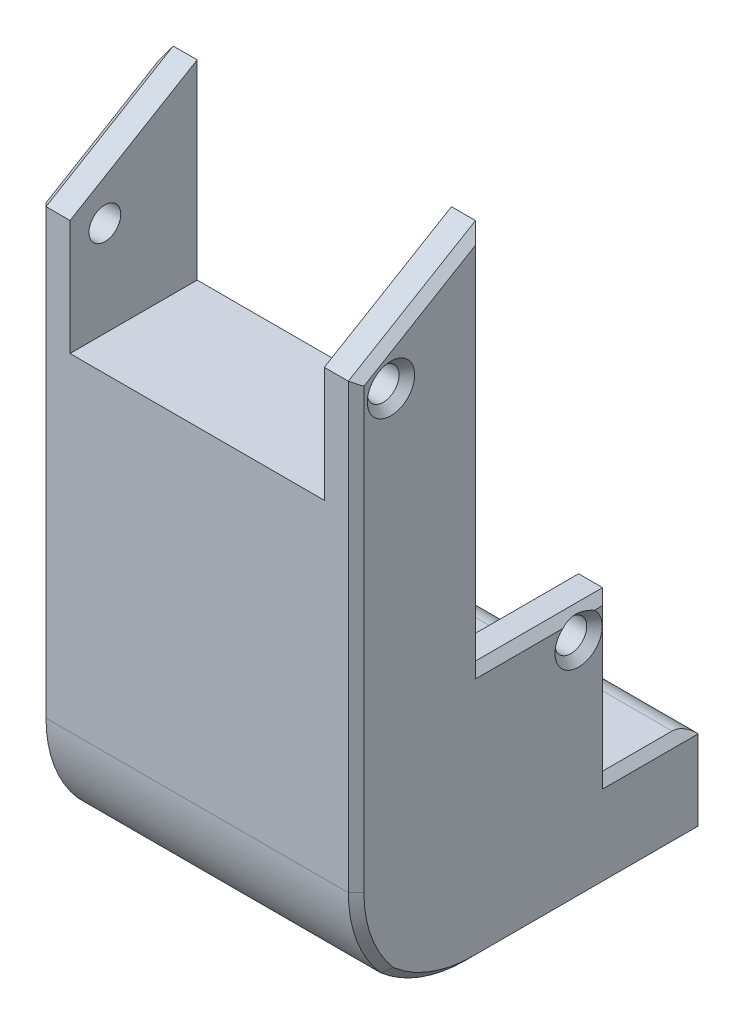
from build123d import *

# Parameters (mm, degrees)
SKETCH_1_W                = 5
SKETCH_1_H                = 10
EXTRUDE_1_DEPTH           = 4
CUT_EXTRUDE_1_DEPTH       = 9.124038405
CUT_EXTRUDE_1_DEPTH_BACK  = 9.124038405
CUT_EXTRUDE_2_DEPTH       = 9.124038405
CUT_EXTRUDE_2_DEPTH_BACK  = 9.124038405
SKETCH_6_W                = 4
SKETCH_6_H                = 3
CUT_EXTRUDE_3_DEPTH       = 2.5
SKETCH_7_W                = 4
SKETCH_7_H                = 3
CUT_EXTRUDE_4_DEPTH       = 2.5
CUT_EXTRUDE_5_DEPTH       = 9.124038405
CUT_EXTRUDE_5_DEPTH_BACK  = 9.124038405
CUT_EXTRUDE_10_DEPTH      = 9.124038405
CUT_EXTRUDE_10_DEPTH_BACK = 5
SKETCH_11_R               = 0.25
CUT_EXTRUDE_11_DEPTH      = 5
SKETCH_12_R               = 0.25
CUT_EXTRUDE_12_DEPTH      = 5
EXTRUDE_3_DEPTH           = 5
SCALE_1_SCALE             = 2.454545455
FILLET_1_R                = 5
CHAMFER_1_SIZE            = 0.3
FILLET_2_R                = 1


with BuildPart() as part:
    # 草图1 → 凸台-拉伸1 (new body)
    with BuildSketch(Plane.XY):
        Rectangle(SKETCH_1_W, SKETCH_1_H)
    extrude(amount=EXTRUDE_1_DEPTH)

    # 草图2 → 切除-拉伸1 (cut, two sides: drawn at the far end of the back side and taken through both)
    with BuildSketch(Plane(origin=(2.5, 0, 0), x_dir=(0, 0, -1), z_dir=(1, 0, 0)).offset(-CUT_EXTRUDE_1_DEPTH_BACK)):
        Polygon((-30.132775887, -11.712260262), (-4, 3.811901084), (-2, 5), (24.132775887, 20.524161347), (-6.915546806, 72.789713121), (-61.181098581, 40.553291512), align=None)
    extrude(amount=CUT_EXTRUDE_1_DEPTH + CUT_EXTRUDE_1_DEPTH_BACK, mode=Mode.SUBTRACT)

    # 草图3 → 切除-拉伸2 (cut, two sides: drawn at the far end of the back side and taken through both)
    with BuildSketch(Plane(origin=(2.5, 0, 0), x_dir=(0, 0, -1), z_dir=(1, 0, 0)).offset(-CUT_EXTRUDE_2_DEPTH_BACK)):
        Polygon((-2, 35.396078054), (-2, 5), (-2, -1), (0, -1), (30.396078054, -1), (75.805427436, 39.418773275), (43.409349382, 75.814851329), align=None)
    extrude(amount=CUT_EXTRUDE_2_DEPTH + CUT_EXTRUDE_2_DEPTH_BACK, mode=Mode.SUBTRACT)

    # 草图6 → 切除-拉伸3 (cut)
    with BuildSketch(Plane(origin=(0, -1, 0), x_dir=(1, 0, 0), z_dir=(0, 1, 0))):
        with Locations((0, -1.5)):
            Rectangle(SKETCH_6_W, SKETCH_6_H)
    extrude(amount=-CUT_EXTRUDE_3_DEPTH, mode=Mode.SUBTRACT)

    # 草图7 → 切除-拉伸4 (cut)
    with BuildSketch(Plane(origin=(0, 0, 2), x_dir=(-1, 0, 0), z_dir=(0, 0, -1))):
        with Locations((0, 3.5)):
            Rectangle(SKETCH_7_W, SKETCH_7_H)
    extrude(amount=-CUT_EXTRUDE_4_DEPTH, mode=Mode.SUBTRACT)

    # 草图8 → 切除-拉伸5 (cut, two sides: drawn at the far end of the back side and taken through both)
    with BuildSketch(Plane(origin=(2.5, 0, 0), x_dir=(0, 0, -1), z_dir=(1, 0, 0)).offset(-CUT_EXTRUDE_5_DEPTH_BACK)):
        Polygon((-25.835890872, 17.835890872), (-4, -4), (-3, -5), (18.835890872, -26.835890872), (-24.835890872, -70.507672616), (-69.507672616, -25.835890872), align=None)
    extrude(amount=CUT_EXTRUDE_5_DEPTH + CUT_EXTRUDE_5_DEPTH_BACK, mode=Mode.SUBTRACT)

    # 草图9 → 切除-拉伸10 (cut, two sides: drawn at the far end of the back side and taken through both)
    with BuildSketch(Plane(origin=(2.5, 0, 0), x_dir=(0, 0, -1), z_dir=(1, 0, 0)).offset(-CUT_EXTRUDE_10_DEPTH_BACK)):
        Polygon((-23.148447549, -26.648447549), (-1.5, -5), (0, -3.5), (21.648447549, 18.148447549), (64.945342647, -25.148447549), (20.148447549, -69.945342647), align=None)
    extrude(amount=CUT_EXTRUDE_10_DEPTH + CUT_EXTRUDE_10_DEPTH_BACK, mode=Mode.SUBTRACT)

    # 草图11 → 切除-拉伸11 (cut)
    with BuildSketch(Plane(origin=(2.5, 0, 0), x_dir=(0, 0, -1), z_dir=(1, 0, 0))):
        with Locations(Location((-3.451895846, 3.5, 0), (0, 0, 90))):
            Circle(SKETCH_11_R)
    extrude(amount=-CUT_EXTRUDE_11_DEPTH, mode=Mode.SUBTRACT)

    # 草图12 → 切除-拉伸12 (cut)
    with BuildSketch(Plane(origin=(2.5, 0, 0), x_dir=(0, 0, -1), z_dir=(1, 0, 0))):
        with Locations(Location((-0.5, -1.4, 0), (0, 0, 90))):
            Circle(SKETCH_12_R)
    extrude(amount=-CUT_EXTRUDE_12_DEPTH, mode=Mode.SUBTRACT)

    # 草图14 → 凸台-拉伸3 (add)
    with BuildSketch(Plane.ZY.offset(2.5)):
        Polygon((1.5, -5), (-1.5, -5), (-1.5, -3.5), (0, -3.5), align=None)
    extrude(amount=-EXTRUDE_3_DEPTH)


with BuildPart() as part_1:
    # 缩放比例1: scaled about (0, -1.916171136, 2.153711166)
    add(part.part.scale(SCALE_1_SCALE).moved(Location((0, 2.787158016, -3.132670787))))

    # 圆角1
    # the kernel refuses this fillet: 5 mm, written as the material it takes off along each edge
    with BuildSketch(Plane(origin=(11.314033166, -9.485569257, 4.230965577), x_dir=(0, 0.7071067811865475, 0.7071067811865475), z_dir=(-1, 0, 0))) as fillet_1_piece_1:
        with BuildLine():
            CenterArc((FILLET_1_R * 0.414213562373, FILLET_1_R), FILLET_1_R, 225, 45)
            Line((-FILLET_1_R * 0.292893218813, FILLET_1_R * 0.292893218813), (0, 0))
            Line((0, 0), (FILLET_1_R * 0.414213562373, 0))
        make_face()
    extrude(amount=22.628066332, mode=Mode.SUBTRACT)
    with BuildSketch(Plane(origin=(11.314033166, -7.031023802, 6.685511031), x_dir=(0, -0.7071067811865476, -0.7071067811865476), z_dir=(-1, 0, 0))) as fillet_1_piece_2:
        with BuildLine():
            CenterArc((FILLET_1_R * 0.414213562373, -FILLET_1_R), FILLET_1_R, 90, 45)
            Line((-FILLET_1_R * 0.292893218813, -FILLET_1_R * 0.292893218813), (0, 0))
            Line((0, 0), (FILLET_1_R * 0.414213562373, 0))
        make_face()
    extrude(amount=22.628066332, mode=Mode.SUBTRACT)

    # 倒角1
    # the kernel refuses this chamfer: 0.3 mm, written as the material it takes off along each edge
    with BuildSketch(Plane(origin=(6.136363636, -4.95995599, 6.685511031), x_dir=(-0.9996219169112968, 0, 0.027495876610587344), z_dir=(0, 1, 0)), Plane(origin=(-6.136363636, 12.915147392, 6.685511031), x_dir=(0.9996219169112968, 0, 0.027495876610587344), z_dir=(0, -1, 0))) as chamfer_1_piece_1:
        Polygon((CHAMFER_1_SIZE * 0.999621916911, -CHAMFER_1_SIZE * 0.0274958766106), (-CHAMFER_1_SIZE * 0.0274958766106, -CHAMFER_1_SIZE * 0.999621916911), (0, 0), align=None)
    extrude(amount=17.875103383, mode=Mode.SUBTRACT)
    with BuildSketch(Plane(origin=(6.136363636, 15.831390185, 1.776420122), x_dir=(-0.9996219169112968, 0, -0.027495876610586622), z_dir=(0, -1, 0)), Plane(origin=(-6.136363636, 0.332612561, 1.776420122), x_dir=(0.9996219169112965, 0, -0.027495876610589495), z_dir=(0, 1, 0))) as chamfer_1_piece_2:
        Polygon((CHAMFER_1_SIZE * 0.999621916911, -CHAMFER_1_SIZE * 0.0274958766106), (-CHAMFER_1_SIZE * 0.0274958766106, -CHAMFER_1_SIZE * 0.999621916911), (0, 0), align=None)
    extrude(amount=15.498777624, mode=Mode.SUBTRACT)
    with BuildSketch(Plane(origin=(6.136363636, 0.332612561, 1.776420122), x_dir=(0.02749587661059016, -0.9996219169112965, 0), z_dir=(0, 0, -1)), Plane(origin=(-6.136363636, 0.332612561, -3.904175683), x_dir=(-0.027495876610587448, -0.9996219169112968, 0), z_dir=(0, 0, 1))) as chamfer_1_piece_3:
        Polygon((CHAMFER_1_SIZE * 0.999621916911, CHAMFER_1_SIZE * 0.0274958766106), (-CHAMFER_1_SIZE * 0.0274958766106, CHAMFER_1_SIZE * 0.999621916911), (0, 0), align=None)
    extrude(amount=5.680595805, mode=Mode.SUBTRACT)
    with BuildSketch(Plane(origin=(6.136363636, -5.803751075, -3.132670787), x_dir=(0.027495876610587378, 0, 0.9996219169112965), z_dir=(0, 1, 0)), Plane(origin=(-6.136363636, 1.104117458, -3.132670787), x_dir=(-0.027495876610587378, 0, 0.9996219169112965), z_dir=(0, -1, 0))) as chamfer_1_piece_4:
        Polygon((CHAMFER_1_SIZE * 0.999621916911, -CHAMFER_1_SIZE * 0.0274958766106), (-CHAMFER_1_SIZE * 0.0274958766106, -CHAMFER_1_SIZE * 0.999621916911), (0, 0), align=None)
    extrude(amount=6.907868533, mode=Mode.SUBTRACT)
    with BuildSketch(Plane(origin=(-6.136363636, -5.803751075, -7.585993865), x_dir=(-0.027495876610587264, -0.9996219169112968, 0), z_dir=(0, 0, 1))) as chamfer_1_piece_5:
        Polygon((CHAMFER_1_SIZE * 0.999621916911, CHAMFER_1_SIZE * 0.0274958766106), (-CHAMFER_1_SIZE * 0.0274958766106, CHAMFER_1_SIZE * 0.999621916911), (0, 0), align=None)
    extrude(amount=4.453323078, mode=Mode.SUBTRACT)
    with BuildSketch(Plane(origin=(6.136363636, -5.803751075, -7.585993865), x_dir=(0.027495876610587264, -0.9996219169112968, 0), z_dir=(0, 0, 1))) as chamfer_1_piece_6:
        Polygon((CHAMFER_1_SIZE * 0.999621916911, -CHAMFER_1_SIZE * 0.0274958766106), (-CHAMFER_1_SIZE * 0.0274958766106, -CHAMFER_1_SIZE * 0.999621916911), (0, 0), align=None)
    extrude(amount=4.453323078, mode=Mode.SUBTRACT)
    with BuildSketch(Plane(origin=(-6.136363636, -10.257074153, -6.814488969), x_dir=(-0.027495876610587344, 0, 0.9996219169112968), z_dir=(0, 1, 0))) as chamfer_1_piece_7:
        Polygon((CHAMFER_1_SIZE * 0.999621916911, CHAMFER_1_SIZE * 0.0274958766106), (-CHAMFER_1_SIZE * 0.0274958766106, CHAMFER_1_SIZE * 0.999621916911), (0, 0), align=None)
    extrude(amount=5.224827975, mode=Mode.SUBTRACT)
    with BuildSketch(Plane(origin=(6.136363636, -10.257074153, -6.814488969), x_dir=(0.027495876610587344, 0, 0.9996219169112968), z_dir=(0, 1, 0))) as chamfer_1_piece_8:
        Polygon((CHAMFER_1_SIZE * 0.999621916911, -CHAMFER_1_SIZE * 0.0274958766106), (-CHAMFER_1_SIZE * 0.0274958766106, -CHAMFER_1_SIZE * 0.999621916911), (0, 0), align=None)
    extrude(amount=5.224827975, mode=Mode.SUBTRACT)
    with BuildSketch(Plane(origin=(6.136363636, -9.485569257, 2.159897765), x_dir=(0.027495876610587344, 0.9996219169112968, 0), z_dir=(0, 0, -1)), Plane(origin=(-6.136363636, -9.485569257, -7.585993865), x_dir=(-0.027495876610587344, 0.9996219169112968, 0), z_dir=(0, 0, 1))) as chamfer_1_piece_9:
        Polygon((CHAMFER_1_SIZE * 0.999621916911, -CHAMFER_1_SIZE * 0.0274958766106), (-CHAMFER_1_SIZE * 0.0274958766106, -CHAMFER_1_SIZE * 0.999621916911), (0, 0), align=None)
    extrude(amount=9.74589163, mode=Mode.SUBTRACT)
    with BuildSketch(Plane(origin=(6.136363636, -4.485569257, 2.159897765), x_dir=(0, -0.642857600187849, 0.765985708666108), z_dir=(0, 0.765985708666108, 0.642857600187849))) as chamfer_1_piece_10:
        Polygon((5 - CHAMFER_1_SIZE, 0), (5, -CHAMFER_1_SIZE), (5, 0), align=None)
    revolve(axis=Axis((6.136363636, -4.485569257, 2.159897765), (1, 0, 0)), revolution_arc=49.994764907, mode=Mode.SUBTRACT)
    with BuildSketch(Plane(origin=(6.136363636, -4.95995599, 1.685511031), x_dir=(0, 0, 1), z_dir=(0, 1, 0))) as chamfer_1_piece_11:
        Polygon((5 - CHAMFER_1_SIZE, 0), (5, -CHAMFER_1_SIZE), (5, 0), align=None)
    revolve(axis=Axis((6.136363636, -4.95995599, 1.685511031), (1, 0, 0)), revolution_arc=49.994764907, mode=Mode.SUBTRACT)
    with BuildSketch(Plane(origin=(6.136363636, 11.378067107, 5.34016447), x_dir=(0, 1, 0), z_dir=(0, 0, -1))) as chamfer_1_piece_12:
        Polygon((0.613636364 + CHAMFER_1_SIZE, 0), (0.613636364, -CHAMFER_1_SIZE), (0.613636364, 0), align=None)
    revolve(axis=Axis((6.136363636, 11.378067107, 5.34016447), (1, 0, 0)), mode=Mode.SUBTRACT)
    with BuildSketch(Plane(origin=(6.136363636, -0.64920562, -1.90539806), x_dir=(0, 1, 0), z_dir=(0, 0, -1))) as chamfer_1_piece_13:
        Polygon((0.613636364 + CHAMFER_1_SIZE, 0), (0.613636364, -CHAMFER_1_SIZE), (0.613636364, 0), align=None)
    revolve(axis=Axis((6.136363636, -0.64920562, -1.90539806), (1, 0, 0)), mode=Mode.SUBTRACT)
    with BuildSketch(Plane(origin=(-6.136363636, -4.95995599, 1.685511031), x_dir=(0, 0, 1), z_dir=(0, 1, 0))) as chamfer_1_piece_14:
        Polygon((5, CHAMFER_1_SIZE), (5 - CHAMFER_1_SIZE, 0), (5, 0), align=None)
    revolve(axis=Axis((-6.136363636, -4.95995599, 1.685511031), (1, 0, 0)), revolution_arc=49.994764907, mode=Mode.SUBTRACT)
    with BuildSketch(Plane(origin=(-6.136363636, -4.485569257, 2.159897765), x_dir=(0, -0.6428576001878487, 0.7659857086661084), z_dir=(0, 0.7659857086661084, 0.6428576001878487))) as chamfer_1_piece_15:
        Polygon((5 - CHAMFER_1_SIZE, 0), (5, CHAMFER_1_SIZE), (5, 0), align=None)
    revolve(axis=Axis((-6.136363636, -4.485569257, 2.159897765), (1, 0, 0)), revolution_arc=49.994764907, mode=Mode.SUBTRACT)
    with BuildSketch(Plane(origin=(-6.136363636, 11.378067107, 5.34016447), x_dir=(0, 1, 0), z_dir=(0, 0, -1))) as chamfer_1_piece_16:
        Polygon((0.613636364 + CHAMFER_1_SIZE, 0), (0.613636364, CHAMFER_1_SIZE), (0.613636364, 0), align=None)
    revolve(axis=Axis((-6.136363636, 11.378067107, 5.34016447), (1, 0, 0)), mode=Mode.SUBTRACT)
    with BuildSketch(Plane(origin=(-6.136363636, -0.64920562, -1.90539806), x_dir=(0, 1, 0), z_dir=(0, 0, -1))) as chamfer_1_piece_17:
        Polygon((0.613636364 + CHAMFER_1_SIZE, 0), (0.613636364, CHAMFER_1_SIZE), (0.613636364, 0), align=None)
    revolve(axis=Axis((-6.136363636, -0.64920562, -1.90539806), (1, 0, 0)), mode=Mode.SUBTRACT)
    with BuildSketch(Plane(origin=(6.136363636, 11.749612501, 7.348805964), x_dir=(-0.9996219169112968, 0.023639351761111982, 0.014042944096554499), z_dir=(0, 0.5107290920540476, -0.8597417022162227)), Plane(origin=(-6.136363636, 15.453915284, 1.113125189), x_dir=(0.9996219169112968, 0.023639351761111344, 0.014042944096553983), z_dir=(0, -0.5107290920540476, 0.8597417022162227))) as chamfer_1_piece_18:
        Polygon((CHAMFER_1_SIZE * 0.999621916911, -CHAMFER_1_SIZE * 0.0274958766106), (-CHAMFER_1_SIZE * 0.0274958766106, -CHAMFER_1_SIZE * 0.999621916911), (0, 0), align=None)
    extrude(amount=7.252970001, mode=Mode.SUBTRACT)
    with BuildSketch(Plane(origin=(6.136363636, 15.831390185, 1.776420122), x_dir=(-0.9996219169112968, 0, -0.027495876610586622), z_dir=(0, -1, 0))) as chamfer_1_piece_19a_section:
        Polygon((CHAMFER_1_SIZE * 0.999621916911, -CHAMFER_1_SIZE * 0.0274958766106), (-CHAMFER_1_SIZE * 0.0274958766106, -CHAMFER_1_SIZE * 0.999621916911), (0, 0), align=None)
    chamfer_1_piece_19a = extrude(amount=16.27028252, mode=Mode.PRIVATE)
    chamfer_1_piece_19a = split(chamfer_1_piece_19a, bisect_by=Plane(origin=(6.037425548, 0.332612561, 1.87535821), z_dir=(0, -1, 0)), keep=Keep.TOP, mode=Mode.PRIVATE)
    with BuildSketch(Plane(origin=(6.136363636, 0.332612561, 2.547925019), x_dir=(0.027495876610587288, -0.9996219169112968, 0), z_dir=(0, 0, -1))) as chamfer_1_piece_19b_section:
        Polygon((CHAMFER_1_SIZE * 0.999621916911, CHAMFER_1_SIZE * 0.0274958766106), (-CHAMFER_1_SIZE * 0.0274958766106, CHAMFER_1_SIZE * 0.999621916911), (0, 0), align=None)
    chamfer_1_piece_19b = extrude(amount=6.452100702, mode=Mode.PRIVATE)
    chamfer_1_piece_19b = split(chamfer_1_piece_19b, bisect_by=Plane(origin=(6.037425548, 0.233674473, 1.776420122), z_dir=(0, 0, 1)), keep=Keep.TOP, mode=Mode.PRIVATE)
    chamfer_1_piece_19 = chamfer_1_piece_19a & chamfer_1_piece_19b
    add(chamfer_1_piece_19, mode=Mode.SUBTRACT)
    with BuildSketch(Plane(origin=(6.136363636, -6.575255971, -3.132670787), x_dir=(0.027495876610587378, 0, 0.9996219169112965), z_dir=(0, 1, 0))) as chamfer_1_piece_20a_section:
        Polygon((CHAMFER_1_SIZE * 0.999621916911, -CHAMFER_1_SIZE * 0.0274958766106), (-CHAMFER_1_SIZE * 0.0274958766106, -CHAMFER_1_SIZE * 0.999621916911), (0, 0), align=None)
    chamfer_1_piece_20a = extrude(amount=7.679373429, mode=Mode.PRIVATE)
    chamfer_1_piece_20a = split(chamfer_1_piece_20a, bisect_by=Plane(origin=(6.037425548, -5.803751075, -3.033732699), z_dir=(0, -1, 0)), keep=Keep.TOP, mode=Mode.PRIVATE)
    with BuildSketch(Plane(origin=(6.136363636, -5.803751075, -7.585993865), x_dir=(0.027495876610587264, -0.9996219169112968, 0), z_dir=(0, 0, 1))) as chamfer_1_piece_20b_section:
        Polygon((CHAMFER_1_SIZE * 0.999621916911, -CHAMFER_1_SIZE * 0.0274958766106), (-CHAMFER_1_SIZE * 0.0274958766106, -CHAMFER_1_SIZE * 0.999621916911), (0, 0), align=None)
    chamfer_1_piece_20b = extrude(amount=5.224827975, mode=Mode.PRIVATE)
    chamfer_1_piece_20b = split(chamfer_1_piece_20b, bisect_by=Plane(origin=(6.037425548, -5.902689163, -3.132670787), z_dir=(0, 0, 1)), keep=Keep.TOP, mode=Mode.PRIVATE)
    chamfer_1_piece_20 = chamfer_1_piece_20a & chamfer_1_piece_20b
    add(chamfer_1_piece_20, mode=Mode.SUBTRACT)
    with BuildSketch(Plane(origin=(-6.136363636, 1.104117458, -3.132670787), x_dir=(-0.027495876610587378, 0, 0.9996219169112965), z_dir=(0, -1, 0))) as chamfer_1_piece_21a_section:
        Polygon((CHAMFER_1_SIZE * 0.999621916911, -CHAMFER_1_SIZE * 0.0274958766106), (-CHAMFER_1_SIZE * 0.0274958766106, -CHAMFER_1_SIZE * 0.999621916911), (0, 0), align=None)
    chamfer_1_piece_21a = extrude(amount=7.679373429, mode=Mode.PRIVATE)
    chamfer_1_piece_21a = split(chamfer_1_piece_21a, bisect_by=Plane(origin=(-6.037425548, -5.803751075, -3.033732699), z_dir=(0, -1, 0)), keep=Keep.TOP, mode=Mode.PRIVATE)
    with BuildSketch(Plane(origin=(-6.136363636, -5.803751075, -7.585993865), x_dir=(-0.027495876610587264, -0.9996219169112968, 0), z_dir=(0, 0, 1))) as chamfer_1_piece_21b_section:
        Polygon((CHAMFER_1_SIZE * 0.999621916911, CHAMFER_1_SIZE * 0.0274958766106), (-CHAMFER_1_SIZE * 0.0274958766106, CHAMFER_1_SIZE * 0.999621916911), (0, 0), align=None)
    chamfer_1_piece_21b = extrude(amount=5.224827975, mode=Mode.PRIVATE)
    chamfer_1_piece_21b = split(chamfer_1_piece_21b, bisect_by=Plane(origin=(-6.037425548, -5.902689163, -3.132670787), z_dir=(0, 0, 1)), keep=Keep.TOP, mode=Mode.PRIVATE)
    chamfer_1_piece_21 = chamfer_1_piece_21a & chamfer_1_piece_21b
    add(chamfer_1_piece_21, mode=Mode.SUBTRACT)
    with BuildSketch(Plane(origin=(-6.136363636, -0.438892335, 1.776420122), x_dir=(0.9996219169112968, 0, -0.0274958766105867), z_dir=(0, 1, 0))) as chamfer_1_piece_22a_section:
        Polygon((CHAMFER_1_SIZE * 0.999621916911, -CHAMFER_1_SIZE * 0.0274958766106), (-CHAMFER_1_SIZE * 0.0274958766106, -CHAMFER_1_SIZE * 0.999621916911), (0, 0), align=None)
    chamfer_1_piece_22a = extrude(amount=16.27028252, mode=Mode.PRIVATE)
    chamfer_1_piece_22a = split(chamfer_1_piece_22a, bisect_by=Plane(origin=(-6.037425548, 0.332612561, 1.87535821), z_dir=(0, -1, 0)), keep=Keep.TOP, mode=Mode.PRIVATE)
    with BuildSketch(Plane(origin=(-6.136363636, 0.332612561, -3.904175683), x_dir=(-0.027495876610587448, -0.9996219169112968, 0), z_dir=(0, 0, 1))) as chamfer_1_piece_22b_section:
        Polygon((CHAMFER_1_SIZE * 0.999621916911, CHAMFER_1_SIZE * 0.0274958766106), (-CHAMFER_1_SIZE * 0.0274958766106, CHAMFER_1_SIZE * 0.999621916911), (0, 0), align=None)
    chamfer_1_piece_22b = extrude(amount=6.452100702, mode=Mode.PRIVATE)
    chamfer_1_piece_22b = split(chamfer_1_piece_22b, bisect_by=Plane(origin=(-6.037425548, 0.233674473, 1.776420122), z_dir=(0, 0, 1)), keep=Keep.TOP, mode=Mode.PRIVATE)
    chamfer_1_piece_22 = chamfer_1_piece_22a & chamfer_1_piece_22b
    add(chamfer_1_piece_22, mode=Mode.SUBTRACT)

    # 圆角2
    fillet_2_edges = [part_1.edges().sort_by_distance(p)[0] for p in [
        (0, -5.803751075, -6.814488969),
        (0, -9.485569257, -6.814488969),
    ]]
    fillet(fillet_2_edges, radius=FILLET_2_R)


solid = part_1.part
